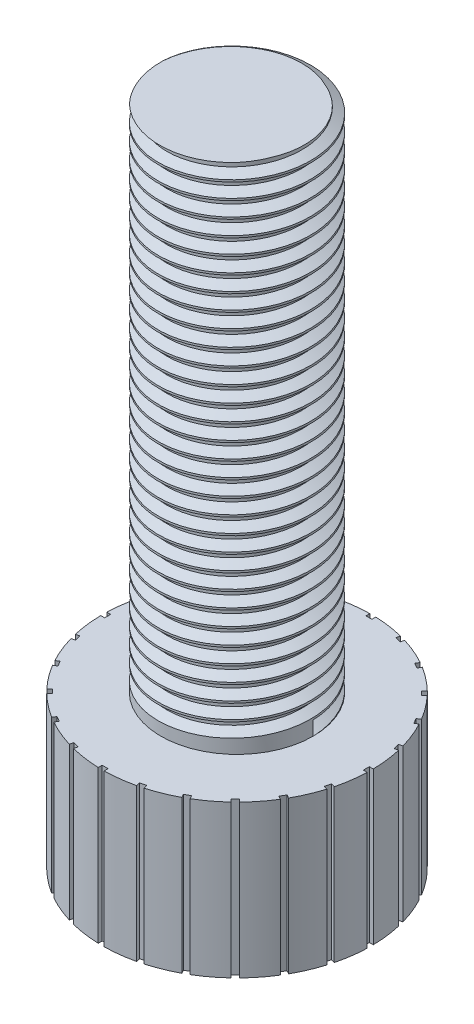
from build123d import *
from build123d.topology import SkipClean

# Parameters (mm, degrees)
SKETCH_1_R               = 2.65
EXTRUDE_1_DEPTH          = 3
SKETCH_2_R               = 1.5
EXTRUDE_2_DEPTH          = 10
THREAD_1_PITCH           = 0.3175
CUT_EXTRUDE_1_DEPTH      = 1
SKETCH_8_W               = 0.180718375
SKETCH_8_H               = 0.118051895
CUT_EXTRUDE_2_DEPTH      = 5
PATTERN_CIRCULAR_1_COUNT = 24


with BuildPart() as part:
    # 草图1 → 凸台-拉伸1 (new body)
    with BuildSketch(Plane(origin=(0, 0, 0), x_dir=(1, 0, 0), z_dir=(0, 1, 0))):
        with Locations(Location((0, 0, 0), (0, 0, 270))):
            Circle(SKETCH_1_R)
    extrude(amount=EXTRUDE_1_DEPTH)

    # Sketch 2 → 凸台-拉伸2 (add)
    with BuildSketch(Plane(origin=(0, 3, 0), x_dir=(1, 0, 0), z_dir=(0, 1, 0))):
        with Locations(Location((0, 0, 0), (0, 0, 270))):
            Circle(SKETCH_2_R)
    extrude(amount=EXTRUDE_2_DEPTH)

    # 螺纹线1: the profile of Sketch 2 2 profile screwed along a right-hand helix of 47.244094 turns, 6 arcs to a turn; built about Z, then put on its axis
    with SkipClean():  # the faces are left unmerged after this step: merging them gives an invalid solid
        thread_1_z = Axis((0, 0, 0), (0, 0, 1))
        thread_1_corners = [(1.5003, 0, -0.000173205), (1.5003, 0, 0.277985704), (1.328148085, 0, 0.17859375), (1.328148085, 0, 0.09921875)]
        with BuildLine(mode=Mode.PRIVATE) as thread_1_profile:
            Line(thread_1_corners[0], thread_1_corners[1])
            Line(thread_1_corners[1], thread_1_corners[2])
            Line(thread_1_corners[2], thread_1_corners[3])
            Line(thread_1_corners[3], thread_1_corners[0])
        thread_1_cap = Face(thread_1_profile.wire())
        thread_1_turn_angles = [0, 30, 60, 90, 120, 150, 180, 210, 240, 270, 300, 330, 360, 390, 420, 450, 480, 510, 540, 570, 600, 630, 660, 690, 720]
        thread_1_turn_weights = [1, 0.8660254037844387, 1, 0.8660254037844387, 1, 0.8660254037844387, 1, 0.8660254037844387, 1, 0.8660254037844387, 1, 0.8660254037844387, 1, 0.8660254037844387, 1, 0.8660254037844387, 1, 0.8660254037844387, 1, 0.8660254037844387, 1, 0.8660254037844387, 1, 0.8660254037844387, 1]
        thread_1_turn_rails = [Edge.make_bspline([Vector(p[0], p[1], 0).rotate(thread_1_z, thread_1_turn_angles[k]) / thread_1_turn_weights[k] + Vector(0, 0, p[2] + THREAD_1_PITCH * thread_1_turn_angles[k] / 360) for k in range(25)], [0, 0, 0, 1, 1, 2, 2, 3, 3, 4, 4, 5, 5, 6, 6, 7, 7, 8, 8, 9, 9, 10, 10, 11, 11, 12, 12, 12], 2, thread_1_turn_weights) for p in thread_1_corners]
        thread_1_turn_sides = [Face.make_surface_from_curves(thread_1_turn_rails[p[0]], thread_1_turn_rails[p[1]]) for p in [(0, 1), (1, 2), (2, 3), (3, 0)]]
        thread_1_last_angles = [16560, 16590, 16620, 16650, 16680, 16710, 16740, 16770, 16800, 16830, 16860, 16890, 16920, 16950, 16980, 16993.937007874, 17007.874015748]
        thread_1_last_weights = [1, 0.8660254037844387, 1, 0.8660254037844387, 1, 0.8660254037844387, 1, 0.8660254037844387, 1, 0.8660254037844387, 1, 0.8660254037844387, 1, 0.8660254037844387, 1, 0.9705611135832078, 1]
        thread_1_last_rails = [Edge.make_bspline([Vector(p[0], p[1], 0).rotate(thread_1_z, thread_1_last_angles[k]) / thread_1_last_weights[k] + Vector(0, 0, p[2] + THREAD_1_PITCH * thread_1_last_angles[k] / 360) for k in range(17)], [0, 0, 0, 1, 1, 2, 2, 3, 3, 4, 4, 5, 5, 6, 6, 7, 7, 8, 8, 8], 2, thread_1_last_weights) for p in thread_1_corners]
        thread_1_last_sides = [Face.make_surface_from_curves(thread_1_last_rails[p[0]], thread_1_last_rails[p[1]]) for p in [(0, 1), (1, 2), (2, 3), (3, 0)]]
        thread_1 = Plane(origin=(0, 3, 0), x_dir=(1, 0, 0), z_dir=(0, 1, 0)) * Solid(Shell([*[p.moved(Location((0, 0, 2 * THREAD_1_PITCH * i))) for i in range(23) for p in thread_1_turn_sides], *thread_1_last_sides, thread_1_cap, thread_1_cap.rotate(thread_1_z, 17007.874015748).moved(Location((0, 0, THREAD_1_PITCH * 17007.874015748 / 360)))]))
        add(thread_1, mode=Mode.SUBTRACT)

    # 草图7 → 切除-拉伸1 (cut)
    with SkipClean():  # the faces are left unmerged after this step: merging them gives an invalid solid
        with BuildSketch(Plane(origin=(0, 0, 0), x_dir=(-1, 0, 0), z_dir=(0, -1, 0))):
            Polygon((-1.443375673, 0), (-0.721687836, -1.25), (0.721687836, -1.25), (1.443375673, 0), (0.721687836, 1.25), (-0.721687836, 1.25), align=None)
        extrude(amount=-CUT_EXTRUDE_1_DEPTH, mode=Mode.SUBTRACT)

    # 草图8 → 切除-拉伸2 (cut)
    with SkipClean():  # the faces are left unmerged after this step: merging them gives an invalid solid
        with BuildSketch(Plane(origin=(0, 0, 0), x_dir=(-1, 0, 0), z_dir=(0, -1, 0))):
            with Locations((-2.662716233, -0.025170528)):
                Rectangle(SKETCH_8_W, SKETCH_8_H)
        cut_extrude_2 = extrude(amount=-CUT_EXTRUDE_2_DEPTH, mode=Mode.SUBTRACT)

    # 阵列(圆周)1: 切除-拉伸2 ×24 about axis
    with SkipClean():  # the faces are left unmerged after this step: merging them gives an invalid solid
        pattern_circular_1_axis = Axis((0, 0, 0), (0, 1, 0))
        for i in range(1, PATTERN_CIRCULAR_1_COUNT):
            add(cut_extrude_2.rotate(pattern_circular_1_axis, i * 360 / PATTERN_CIRCULAR_1_COUNT), mode=Mode.SUBTRACT)


solid = part.part
